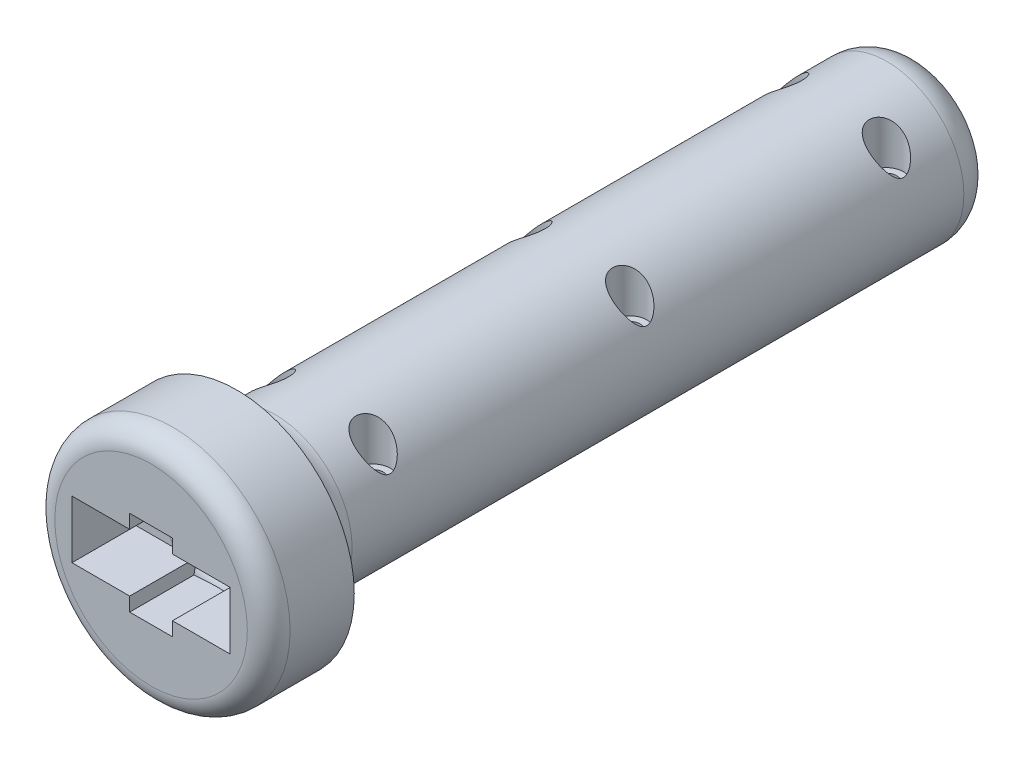
from build123d import *

# Parameters (mm, degrees)
ESQUISSE1_R                                  = 18
BOSS_EXTRU_1_DEPTH                           = 160
CHAMBRAGE_START                              = 5.6
CHAMBRAGE_POUR_VIS_T_TE_HEXAGONALE_2_R       = 4
CHAMBRAGE_POUR_VIS_T_TE_HEXAGONALE_M41_DEPTH = 4.4
CHAMBRAGE_POUR_VIS_T_TE_HEXAGONALE_3_O_R     = 2.4
CHAMBRAGE_POUR_VIS_T_TE_HEXAGONALE_3_DEPTH   = 5.6
ENL_V_MAT_EXTRU_1_REACH                      = 164.73
ESQUISSE4_R                                  = 4
ESQUISSE5_R                                  = 2.35
ENL_V_MAT_EXTRU_2_DEPTH                      = 6
CONG_1_R                                     = 8
ESQUISSE6_R                                  = 27.5
BOSS_EXTRU_2_DEPTH                           = 20
CONG_3_R                                     = 9
ESQUISSE7_W                                  = 37
ESQUISSE7_H                                  = 13.5
ENL_V_MAT_EXTRU_3_DEPTH                      = 15
CONG_4_R                                     = 5
ESQUISSE8_R                                  = 1.5
ENL_V_MAT_EXTRU_4_DEPTH                      = 10
ESQUISSE9_W                                  = 15.8
ESQUISSE9_H                                  = 24.4
ENL_V_MAT_EXTRU_5_DEPTH                      = 1.5
ENL_V_MAT_EXTRU_6_REACH                      = 176.392
ESQUISSE10_R                                 = 3
ESQUISSE11_R                                 = 6.75
ENL_V_MAT_EXTRU_7_DEPTH                      = 10
ESQUISSE12_W                                 = 10
ESQUISSE12_H                                 = 20
ENL_V_MAT_EXTRU_8_DEPTH                      = 15
CONG_5_R                                     = 5
ENL_V_MAT_EXTRU_9_DEPTH                      = 5
ENL_V_MAT_EXTRU_9_DEPTH_BACK                 = 5
ESQUISSE13_W                                 = 15.8
ESQUISSE13_H                                 = 5
ESQUISSE14_R                                 = 6
ENL_V_MAT_EXTRU_10_DEPTH                     = 5


# Read off the part's stored shape, not the designer's step: Chambrage pour vis à tête hexagonale M41
with BuildPart() as part:
    # Esquisse1 → Boss.-Extru.1 (new body)
    with BuildSketch(Plane.XY):
        Circle(ESQUISSE1_R)
    extrude(amount=BOSS_EXTRU_1_DEPTH)

    # Chambrage pour vis _ t_te hexagonale 2 → Chambrage pour vis à tête hexagonale M41 (cut)
    with BuildSketch(Plane(origin=(0, 0, 0), x_dir=(1, 0, 0), z_dir=(0, 1, 0)).offset(CHAMBRAGE_START)):
        with Locations((11.892935103, -140)):
            Circle(CHAMBRAGE_POUR_VIS_T_TE_HEXAGONALE_2_R)
        with Locations((-11.892935103, -140)):
            Circle(CHAMBRAGE_POUR_VIS_T_TE_HEXAGONALE_2_R)
        with Locations((11.892935103, -80)):
            Circle(CHAMBRAGE_POUR_VIS_T_TE_HEXAGONALE_2_R)
        with Locations((-11.892935103, -80)):
            Circle(CHAMBRAGE_POUR_VIS_T_TE_HEXAGONALE_2_R)
        with Locations((11.892935103, -20)):
            Circle(CHAMBRAGE_POUR_VIS_T_TE_HEXAGONALE_2_R)
        with Locations((-11.892935103, -20)):
            Circle(CHAMBRAGE_POUR_VIS_T_TE_HEXAGONALE_2_R)
    extrude(amount=CHAMBRAGE_POUR_VIS_T_TE_HEXAGONALE_M41_DEPTH, mode=Mode.SUBTRACT)

    # Chambrage pour vis _ t_te hexagonale 3 o → Chambrage pour vis _ t_te hexagonale 3 (cut)
    with BuildSketch(Plane(origin=(0, 0, 0), x_dir=(1, 0, 0), z_dir=(0, 1, 0))):
        with Locations((11.892935103, -140)):
            Circle(CHAMBRAGE_POUR_VIS_T_TE_HEXAGONALE_3_O_R)
        with Locations((-11.892935103, -140)):
            Circle(CHAMBRAGE_POUR_VIS_T_TE_HEXAGONALE_3_O_R)
        with Locations((11.892935103, -80)):
            Circle(CHAMBRAGE_POUR_VIS_T_TE_HEXAGONALE_3_O_R)
        with Locations((-11.892935103, -80)):
            Circle(CHAMBRAGE_POUR_VIS_T_TE_HEXAGONALE_3_O_R)
        with Locations((11.892935103, -20)):
            Circle(CHAMBRAGE_POUR_VIS_T_TE_HEXAGONALE_3_O_R)
        with Locations((-11.892935103, -20)):
            Circle(CHAMBRAGE_POUR_VIS_T_TE_HEXAGONALE_3_O_R)
    extrude(amount=CHAMBRAGE_POUR_VIS_T_TE_HEXAGONALE_3_DEPTH, mode=Mode.SUBTRACT)

    # Esquisse4 → Enlèv. mat.-Extru.1 (cut, up to next)
    with BuildSketch(Plane(origin=(0, 5.6, 0), x_dir=(1, 0, 0), z_dir=(0, 1, 0)), mode=Mode.PRIVATE) as enl_v_mat_extru_1_sk1:
        with Locations(Location((11.892935103, -20, 0), (0, 0, 270))):
            Circle(ESQUISSE4_R)
    enl_v_mat_extru_1_tool1 = extrude(enl_v_mat_extru_1_sk1.sketch, amount=ENL_V_MAT_EXTRU_1_REACH, mode=Mode.PRIVATE) & part.part
    # Esquisse4 → Enlèv. mat.-Extru.1 (cut, up to next)
    with BuildSketch(Plane(origin=(0, 5.6, 0), x_dir=(1, 0, 0), z_dir=(0, 1, 0)), mode=Mode.PRIVATE) as enl_v_mat_extru_1_sk2:
        with Locations(Location((11.892935103, -80, 0), (0, 0, 270))):
            Circle(ESQUISSE4_R)
    enl_v_mat_extru_1_tool2 = extrude(enl_v_mat_extru_1_sk2.sketch, amount=ENL_V_MAT_EXTRU_1_REACH, mode=Mode.PRIVATE) & part.part
    # Esquisse4 → Enlèv. mat.-Extru.1 (cut, up to next)
    with BuildSketch(Plane(origin=(0, 5.6, 0), x_dir=(1, 0, 0), z_dir=(0, 1, 0)), mode=Mode.PRIVATE) as enl_v_mat_extru_1_sk3:
        with Locations(Location((-11.892935103, -80, 0), (0, 0, 270))):
            Circle(ESQUISSE4_R)
    enl_v_mat_extru_1_tool3 = extrude(enl_v_mat_extru_1_sk3.sketch, amount=ENL_V_MAT_EXTRU_1_REACH, mode=Mode.PRIVATE) & part.part
    # Esquisse4 → Enlèv. mat.-Extru.1 (cut, up to next)
    with BuildSketch(Plane(origin=(0, 5.6, 0), x_dir=(1, 0, 0), z_dir=(0, 1, 0)), mode=Mode.PRIVATE) as enl_v_mat_extru_1_sk4:
        with Locations(Location((11.892935103, -140, 0), (0, 0, 270))):
            Circle(ESQUISSE4_R)
    enl_v_mat_extru_1_tool4 = extrude(enl_v_mat_extru_1_sk4.sketch, amount=ENL_V_MAT_EXTRU_1_REACH, mode=Mode.PRIVATE) & part.part
    # Esquisse4 → Enlèv. mat.-Extru.1 (cut, up to next)
    with BuildSketch(Plane(origin=(0, 5.6, 0), x_dir=(1, 0, 0), z_dir=(0, 1, 0)), mode=Mode.PRIVATE) as enl_v_mat_extru_1_sk5:
        with Locations(Location((-11.892935103, -140, 0), (0, 0, 270))):
            Circle(ESQUISSE4_R)
    enl_v_mat_extru_1_tool5 = extrude(enl_v_mat_extru_1_sk5.sketch, amount=ENL_V_MAT_EXTRU_1_REACH, mode=Mode.PRIVATE) & part.part
    # Esquisse4 → Enlèv. mat.-Extru.1 (cut, up to next)
    with BuildSketch(Plane(origin=(0, 5.6, 0), x_dir=(1, 0, 0), z_dir=(0, 1, 0)), mode=Mode.PRIVATE) as enl_v_mat_extru_1_sk6:
        with Locations(Location((-11.892935103, -20, 0), (0, 0, 270))):
            Circle(ESQUISSE4_R)
    enl_v_mat_extru_1_tool6 = extrude(enl_v_mat_extru_1_sk6.sketch, amount=ENL_V_MAT_EXTRU_1_REACH, mode=Mode.PRIVATE) & part.part
    add(enl_v_mat_extru_1_tool1.solids().sort_by_distance((11.892935, 5.6, 20))[0], mode=Mode.SUBTRACT)
    add(enl_v_mat_extru_1_tool2.solids().sort_by_distance((11.892935, 5.6, 80))[0], mode=Mode.SUBTRACT)
    add(enl_v_mat_extru_1_tool3.solids().sort_by_distance((-11.892935, 5.6, 80))[0], mode=Mode.SUBTRACT)
    add(enl_v_mat_extru_1_tool4.solids().sort_by_distance((11.892935, 5.6, 140))[0], mode=Mode.SUBTRACT)
    add(enl_v_mat_extru_1_tool5.solids().sort_by_distance((-11.892935, 5.6, 140))[0], mode=Mode.SUBTRACT)
    add(enl_v_mat_extru_1_tool6.solids().sort_by_distance((-11.892935, 5.6, 20))[0], mode=Mode.SUBTRACT)

    # Esquisse5 → Enlèv. mat.-Extru.2 (cut)
    with BuildSketch(Plane(origin=(0, 0, 0), x_dir=(1, 0, 0), z_dir=(0, 1, 0))):
        with Locations(Location((-11.892935103, -140, 0), (0, 0, 270))):
            Circle(ESQUISSE5_R)
        with Locations(Location((11.892935103, -140, 0), (0, 0, 270))):
            Circle(ESQUISSE5_R)
        with Locations(Location((11.892935103, -80, 0), (0, 0, 270))):
            Circle(ESQUISSE5_R)
        with Locations(Location((-11.892935103, -80, 0), (0, 0, 270))):
            Circle(ESQUISSE5_R)
        with Locations(Location((11.892935103, -20, 0), (0, 0, 270))):
            Circle(ESQUISSE5_R)
        with Locations(Location((-11.892935103, -20, 0), (0, 0, 270))):
            Circle(ESQUISSE5_R)
    extrude(amount=-ENL_V_MAT_EXTRU_2_DEPTH, mode=Mode.SUBTRACT)

    # Congé1
    cong_1_edges = [part.edges().sort_by_distance(p)[0] for p in [
        (-18, 0, 0),
    ]]
    fillet(cong_1_edges, radius=CONG_1_R)

    # Esquisse6 → Boss.-Extru.2 (add)
    with BuildSketch(Plane.XY.offset(160)):
        Circle(ESQUISSE6_R)
    extrude(amount=BOSS_EXTRU_2_DEPTH)

    # Congé3
    cong_3_edges = [part.edges().sort_by_distance(p)[0] for p in [
        (-18, 0, 160),
    ]]
    fillet(cong_3_edges, radius=CONG_3_R)

    # Esquisse7 → Enlèv. mat.-Extru.3 (cut)
    with BuildSketch(Plane.XY.offset(180)):
        Rectangle(ESQUISSE7_W, ESQUISSE7_H)
    extrude(amount=-ENL_V_MAT_EXTRU_3_DEPTH, mode=Mode.SUBTRACT)

    # Congé4
    cong_4_edges = [part.edges().sort_by_distance(p)[0] for p in [
        (-27.5, 0, 180),
    ]]
    fillet(cong_4_edges, radius=CONG_4_R)

    # Esquisse8 → Enlèv. mat.-Extru.4 (cut)
    with BuildSketch(Plane(origin=(0, 0, 0), x_dir=(-1, 0, 0), z_dir=(0, 0, -1))):
        Circle(ESQUISSE8_R)
    extrude(amount=-ENL_V_MAT_EXTRU_4_DEPTH, mode=Mode.SUBTRACT)

    # Esquisse9 → Enlèv. mat.-Extru.5 (cut, symmetric)
    with BuildSketch(Plane(origin=(0, 0, 0), x_dir=(1, 0, 0), z_dir=(0, 1, 0))):
        with Locations((0, -45.194635726)):
            Rectangle(ESQUISSE9_W, ESQUISSE9_H)
    extrude(amount=ENL_V_MAT_EXTRU_5_DEPTH, both=True, mode=Mode.SUBTRACT)

    # Esquisse10 → Enlèv. mat.-Extru.6 (cut, up to next)
    with BuildSketch(Plane(origin=(0, 0, 10), x_dir=(-1, 0, 0), z_dir=(0, 0, -1)), mode=Mode.PRIVATE) as enl_v_mat_extru_6_sk1:
        Circle(ESQUISSE10_R)
    enl_v_mat_extru_6_tool1 = extrude(enl_v_mat_extru_6_sk1.sketch, amount=-ENL_V_MAT_EXTRU_6_REACH, mode=Mode.PRIVATE) & part.part
    add(enl_v_mat_extru_6_tool1.solids().sort_by_distance((0, 0, 10))[0], mode=Mode.SUBTRACT)

    # Esquisse11 → Enlèv. mat.-Extru.7 (cut)
    with BuildSketch(Plane.XY.offset(165)):
        Circle(ESQUISSE11_R)
    extrude(amount=-ENL_V_MAT_EXTRU_7_DEPTH, mode=Mode.SUBTRACT)

    # Esquisse12 → Enlèv. mat.-Extru.8 (cut)
    with BuildSketch(Plane.XY.offset(180)):
        Rectangle(ESQUISSE12_W, ESQUISSE12_H)
    extrude(amount=-ENL_V_MAT_EXTRU_8_DEPTH, mode=Mode.SUBTRACT)

    # Congé5
    # the kernel refuses this fillet: 5 mm, written as the material it takes off along each edge
    with BuildSketch(Plane(origin=(0, 0, 165), x_dir=(1, 0, 0), z_dir=(0, 1, 0))) as cong_5_piece_1_section:
        with BuildLine():
            CenterArc((6.75 + CONG_5_R, CONG_5_R), CONG_5_R, 180, 90)
            Line((6.75 + CONG_5_R, 0), (6.75, 0))
            Line((6.75, 0), (6.75, CONG_5_R))
        make_face()
    cong_5_piece_1 = revolve(axis=Axis((0, 0, 165), (0, 0, -1)), mode=Mode.PRIVATE)
    cong_5_piece_1 = split(cong_5_piece_1, bisect_by=Plane(origin=(7.086770181, 6.75, 163.964992462), z_dir=(0, -1, 0)), keep=Keep.TOP, mode=Mode.PRIVATE)
    cong_5_piece_1 = split(cong_5_piece_1, bisect_by=Plane(origin=(7.086770181, -6.75, 163.964992462), z_dir=(0, 1, 0)), keep=Keep.TOP, mode=Mode.PRIVATE)
    add(cong_5_piece_1, mode=Mode.SUBTRACT)
    with BuildSketch(Plane(origin=(0, 0, 165), x_dir=(1, 0, 0), z_dir=(0, 1, 0))) as cong_5_piece_2_section:
        with BuildLine():
            CenterArc((6.75 + CONG_5_R, CONG_5_R), CONG_5_R, 180, 90)
            Line((6.75 + CONG_5_R, 0), (6.75, 0))
            Line((6.75, 0), (6.75, CONG_5_R))
        make_face()
    cong_5_piece_2 = revolve(axis=Axis((0, 0, 165), (0, 0, -1)), mode=Mode.PRIVATE)
    cong_5_piece_2 = split(cong_5_piece_2, bisect_by=Plane(origin=(5, -7.778218527, 164.112087838), z_dir=(-1, 0, 0)), keep=Keep.TOP, mode=Mode.PRIVATE)
    cong_5_piece_2 = split(cong_5_piece_2, bisect_by=Plane(origin=(1.03e-07, 10, 164.112087838), z_dir=(0, -1, 0)), keep=Keep.TOP, mode=Mode.PRIVATE)
    cong_5_piece_2 = split(cong_5_piece_2, bisect_by=Plane(origin=(-5, -7.778218527, 164.112087838), z_dir=(1, 0, 0)), keep=Keep.TOP, mode=Mode.PRIVATE)
    cong_5_piece_2 = split(cong_5_piece_2, bisect_by=Plane(origin=(1.03e-07, -10, 164.112087838), z_dir=(0, 1, 0)), keep=Keep.TOP, mode=Mode.PRIVATE)
    add(cong_5_piece_2, mode=Mode.SUBTRACT)

    # Esquisse13 → Enlèv. mat.-Extru.9 (cut, two sides: drawn at the far end of the back side and taken through both)
    with BuildSketch(Plane(origin=(0, 0, 0), x_dir=(1, 0, 0), z_dir=(0, 1, 0)).offset(-ENL_V_MAT_EXTRU_9_DEPTH_BACK)):
        with Locations((0, -54.894635726)):
            Rectangle(ESQUISSE13_W, ESQUISSE13_H)
        with Locations((0, -35.494635726)):
            Rectangle(ESQUISSE13_W, ESQUISSE13_H)
    extrude(amount=ENL_V_MAT_EXTRU_9_DEPTH + ENL_V_MAT_EXTRU_9_DEPTH_BACK, mode=Mode.SUBTRACT)

    # Esquisse14 → Enlèv. mat.-Extru.10 (cut)
    with BuildSketch(Plane.XY.offset(10)):
        Circle(ESQUISSE14_R)
    extrude(amount=ENL_V_MAT_EXTRU_10_DEPTH, mode=Mode.SUBTRACT)


solid = part.part
